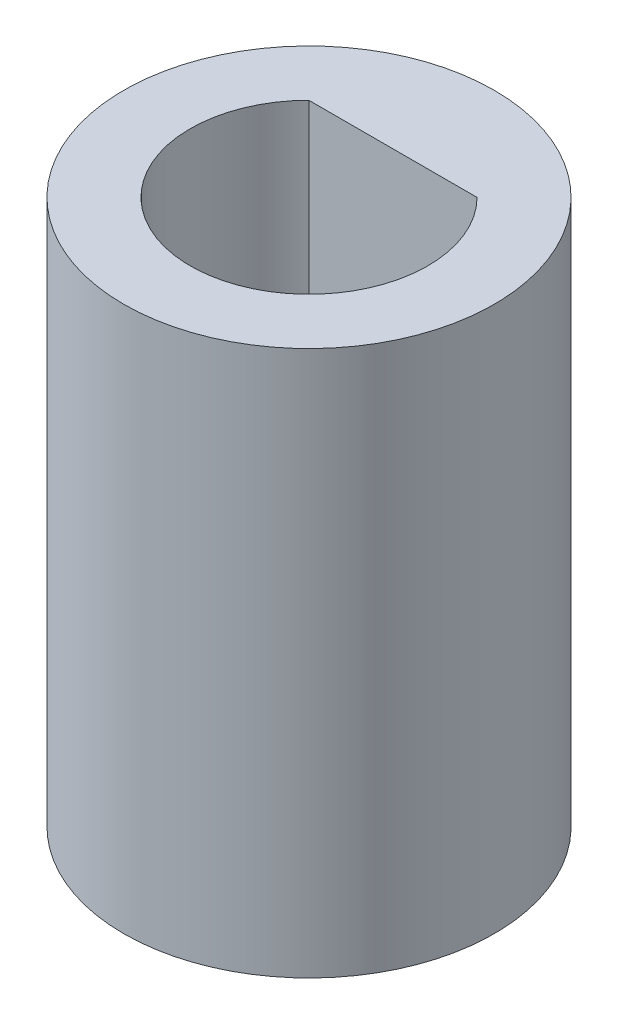
from build123d import *

# Parameters (mm, degrees)
SKETCH1_R           = 5.575
BOSS_EXTRUDE1_DEPTH = 16.4
CUT_EXTRUDE1_DEPTH  = 19.196737345


with BuildPart() as part:
    # Sketch1 → Boss-Extrude1 (new body)
    with BuildSketch(Plane(origin=(0, 0, 0), x_dir=(1, 0, 0), z_dir=(0, 1, 0))):
        Circle(SKETCH1_R)
    extrude(amount=-BOSS_EXTRUDE1_DEPTH)

    # Sketch3 → Cut-Extrude1 (cut, through all)
    with BuildSketch(Plane(origin=(0, 0, 0), x_dir=(1, 0, 0), z_dir=(0, 1, 0))):
        with BuildLine():
            Line((-2.530810147, 2.525), (2.530810147, 2.525))
            ThreePointArc((2.530810147, 2.525), (0, -3.575), (-2.530810147, 2.525))
        make_face()
    extrude(amount=-CUT_EXTRUDE1_DEPTH, mode=Mode.SUBTRACT)


solid = part.part
